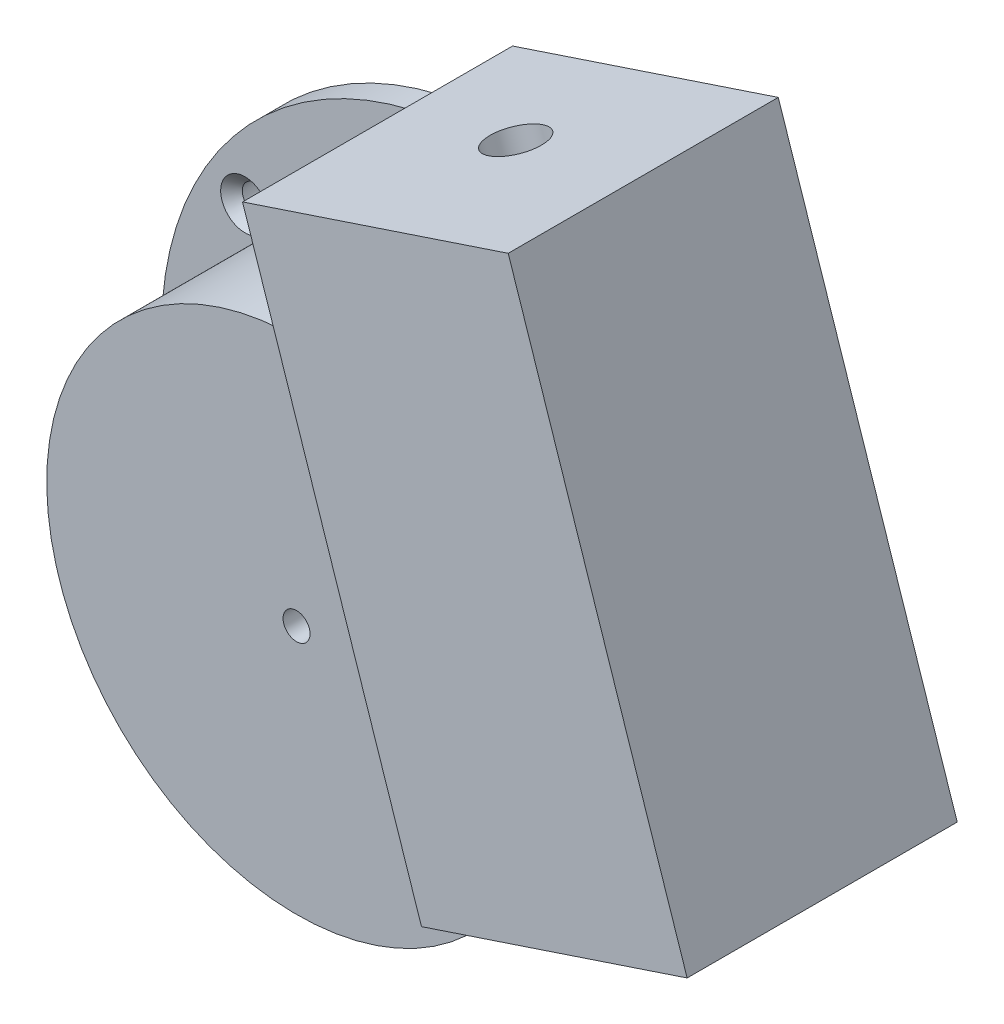
from build123d import *
from build123d.topology import SkipClean

# Parameters (mm, degrees)
ESTRUSIONE_ESTRUSIONE1_DEPTH             = 2
ESTRUSIONE_ESTRUSIONE3_DEPTH             = 12
ESTRUSIONE_ESTRUSIONE4_DEPTH             = 12
SCHIZZO7_R                               = 17
TAGLIO_ESTRUSIONE1_DEPTH                 = 12
ESTRUSIONE_ESTRUSIONE5_DEPTH             = 4
ESTRUSIONE_ESTRUSIONE6_DEPTH             = 2
SCHIZZO12_R                              = 18.5
ESTRUSIONE_ESTRUSIONE7_DEPTH             = 2
SCHIZZO13_R                              = 1
TAGLIO_ESTRUSIONE2_DEPTH                 = 2
SCHIZZO14_R                              = 1.9999999999999996
TAGLIO_ESTRUSIONE3_DEPTH                 = 2
FORO_SVASATO_PER_VITE_M1_6_1_D           = 2
FORO_SVASATO_PER_VITE_M1_6_1_CSINK_D     = 3.6
FORO_SVASATO_PER_VITE_M1_6_1_CSINK_ANGLE = 90


with BuildPart() as part:
    # Schizzo1 → Estrusione-Estrusione1 (new body)
    with BuildSketch(Plane.XY):
        with BuildLine():
            Line((1.7521545270351044, 23.935955266364257), (0, 29.20537764983825))
            Line((0, 29.20537764983825), (19.6753238609994, 35.74769012075539))
            Line((19.6753238609994, 35.74769012075539), (32.92722566640575, -4.1060253589917055))
            Line((32.92722566640575, -4.1060253589917055), (22.80756216564372, -7.470950947523162))
            ThreePointArc((22.80756216564372, -7.470950947523162), (-19.934727499721227, -13.364379503435943), (1.7521545270351044, 23.935955266364257))
        make_face()
        with BuildLine():
            Line((4.2368221069293845, 16.46357611317282), (13.251901805406366, -10.648337829908835))
            ThreePointArc((13.251901805406366, -10.648337829908835), (-16.131578826473948, -5.3639691055465315), (4.2368221069293845, 16.46357611317282))
        make_face(mode=Mode.SUBTRACT)
    extrude(amount=ESTRUSIONE_ESTRUSIONE1_DEPTH)

    # Schizzo3 → Estrusione-Estrusione3 (add)
    with SkipClean():  # the faces are left unmerged after this step: merging them gives an invalid solid
        with BuildSketch(Plane.XY.offset(2)):
            with BuildLine():
                Line((13.25190180540636, -10.64833782990884), (15.661571428601047, -9.84708994509684))
                ThreePointArc((15.661571428601047, -9.84708994509684), (-17.00666852177596, -7.281704868396873), (3.6828047807986604, 18.12972556180944))
                Line((3.6828047807986604, 18.12972556180944), (4.236822106929399, 16.463576113172813))
                ThreePointArc((4.236822106929399, 16.463576113172813), (-16.131578826473945, -5.363969105546531), (13.25190180540636, -10.64833782990884))
            make_face()
        extrude(amount=ESTRUSIONE_ESTRUSIONE3_DEPTH)

    # Schizzo5 → Estrusione-Estrusione4 (add)
    with SkipClean():  # the faces are left unmerged after this step: merging them gives an invalid solid
        with BuildSketch(Plane.XY.offset(2)):
            Polygon((4.2368221069293845, 16.46357611317282), (9.20072700457541, 7.873738581138368), (2.5288879920024105, 27.938600035611493), (18.408546246772644, 33.21880212875297), (30.39833767440335, -2.8392477447649496), (12.62084661651854, -8.75050502679426), (13.251901805406368, -10.648337829908835), (32.92722566640575, -4.1060253589917055), (19.6753238609994, 35.74769012075539), (0, 29.20537764983825), align=None)
        extrude(amount=ESTRUSIONE_ESTRUSIONE4_DEPTH)

    # Schizzo7 → Taglio-Estrusione1 (cut, symmetric)
    with SkipClean():  # the faces are left unmerged after this step: merging them gives an invalid solid
        with BuildSketch(Plane.XY.offset(2)):
            Circle(SCHIZZO7_R)
        extrude(amount=TAGLIO_ESTRUSIONE1_DEPTH, both=True, mode=Mode.SUBTRACT)

    # Schizzo10 → Estrusione-Estrusione5 (add)
    with SkipClean():  # the faces are left unmerged after this step: merging them gives an invalid solid
        with BuildSketch(Plane.XY.offset(14)):
            Polygon((32.92722566640575, -4.1060253589917055), (13.251901805406353, -10.648337829908842), (0, 29.20537764983825), (19.6753238609994, 35.74769012075539), align=None)
            Polygon((30.39833767440335, -2.8392477447649496), (14.51867941963312, -8.119449837906433), (2.5288879920024105, 27.938600035611493), (18.408546246772644, 33.21880212875297), align=None, mode=Mode.SUBTRACT)
        extrude(amount=ESTRUSIONE_ESTRUSIONE5_DEPTH)

    # Schizzo11 → Estrusione-Estrusione6 (add)
    with SkipClean():  # the faces are left unmerged after this step: merging them gives an invalid solid
        with BuildSketch(Plane.XY.offset(18.000000000000004)):
            Polygon((32.92722566640575, -4.1060253589917055), (13.25190180540637, -10.648337829908844), (0, 29.20537764983825), (19.6753238609994, 35.74769012075539), align=None)
        extrude(amount=ESTRUSIONE_ESTRUSIONE6_DEPTH)

    # Schizzo12 → Estrusione-Estrusione7 (add)
    with SkipClean():  # the faces are left unmerged after this step: merging them gives an invalid solid
        with BuildSketch(Plane.XY.offset(14)):
            Circle(SCHIZZO12_R)
        extrude(amount=ESTRUSIONE_ESTRUSIONE7_DEPTH)

    # Schizzo13 → Taglio-Estrusione2 (cut)
    with SkipClean():  # the faces are left unmerged after this step: merging them gives an invalid solid
        with BuildSketch(Plane.XY.offset(16)):
            Circle(SCHIZZO13_R)
        extrude(amount=-TAGLIO_ESTRUSIONE2_DEPTH, mode=Mode.SUBTRACT)

    # Schizzo14 → Taglio-Estrusione3 (cut)
    with SkipClean():  # the faces are left unmerged after this step: merging them gives an invalid solid
        with BuildSketch(Plane(origin=(-8.744361956167872, 26.29775850820628, 0), x_dir=(0.9489164015572907, 0.31552759444391354, 0), z_dir=(-0.31552759444391354, 0.9489164015572907, 0))):
            with Locations((18.94410254301622, -9.000000000000004)):
                Circle(SCHIZZO14_R)
        extrude(amount=-TAGLIO_ESTRUSIONE3_DEPTH, mode=Mode.SUBTRACT)

    # Foro svasato per Vite M1.6-1 (through all)
    with Locations(Plane(origin=(0.714435954, 20.987843655, 2), x_dir=(1, 0, 0), z_dir=(0, 0, 1))):
        with Locations((0, 0), (-18.533223752, -9.875202142), (-11.827077467, -38.806631453), (17.104351844, -32.100485168)):
            CounterSinkHole(FORO_SVASATO_PER_VITE_M1_6_1_D / 2, FORO_SVASATO_PER_VITE_M1_6_1_CSINK_D / 2, counter_sink_angle=FORO_SVASATO_PER_VITE_M1_6_1_CSINK_ANGLE)


solid = part.part
